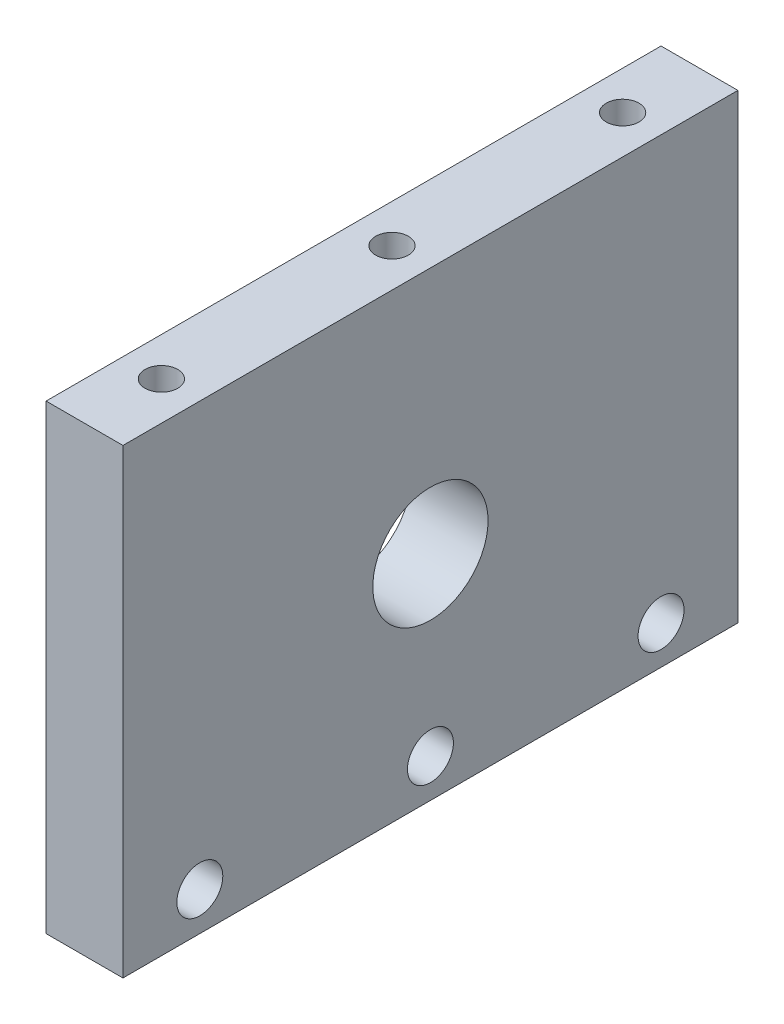
from build123d import *

# Parameters (mm, degrees)
SKETCH1_W                 = 50.8
SKETCH1_H                 = 38.1
BOSS_EXTRUDE1_DEPTH       = 6.35
SKETCH3_R                 = 1.89865
CUT_EXTRUDE1_DEPTH        = 6.35
F_6_32_TAPPED_HOLE1_D     = 2.7051
F_6_32_TAPPED_HOLE1_DEPTH = 11.88730597
F_6_32_TAPPED_HOLE1_TIP   = 0.81269403
SKETCH12_R                = 4.7625
CUT_EXTRUDE3_DEPTH        = 6.35


with BuildPart() as part:
    # Sketch1 → Boss-Extrude1 (new body)
    with BuildSketch(Plane(origin=(0, 0, 0), x_dir=(0, 0, -1), z_dir=(1, 0, 0))):
        with Locations((-25.4, 19.05)):
            Rectangle(SKETCH1_W, SKETCH1_H)
    extrude(amount=BOSS_EXTRUDE1_DEPTH)

    # Sketch3 → Cut-Extrude1 (cut)
    with BuildSketch(Plane(origin=(6.35, 0, 0), x_dir=(0, 0, -1), z_dir=(1, 0, 0))):
        with Locations((-44.45, 3.175)):
            Circle(SKETCH3_R)
        with Locations((-25.4, 3.175)):
            Circle(SKETCH3_R)
        with Locations((-6.35, 3.175)):
            Circle(SKETCH3_R)
    extrude(amount=-CUT_EXTRUDE1_DEPTH, mode=Mode.SUBTRACT)

    # #6-32 Tapped Hole1
    with Locations(Plane(origin=(0, 38.1, 0), x_dir=(1, 0, 0), z_dir=(0, 1, 0))):
        with Locations((3.175, -6.35), (3.175, -25.4), (3.175, -44.45)):
            Hole(F_6_32_TAPPED_HOLE1_D / 2, depth=F_6_32_TAPPED_HOLE1_DEPTH)
            with Locations((0, 0, -(F_6_32_TAPPED_HOLE1_DEPTH + F_6_32_TAPPED_HOLE1_TIP / 2))):  # 118° drill point
                Cone(0, F_6_32_TAPPED_HOLE1_D / 2, F_6_32_TAPPED_HOLE1_TIP, mode=Mode.SUBTRACT)

    # Sketch12 → Cut-Extrude3 (cut)
    with BuildSketch(Plane(origin=(6.35, 0, 0), x_dir=(0, 0, -1), z_dir=(1, 0, 0))):
        with Locations((-25.4, 17.653)):
            Circle(SKETCH12_R)
    extrude(amount=-CUT_EXTRUDE3_DEPTH, mode=Mode.SUBTRACT)


solid = part.part
